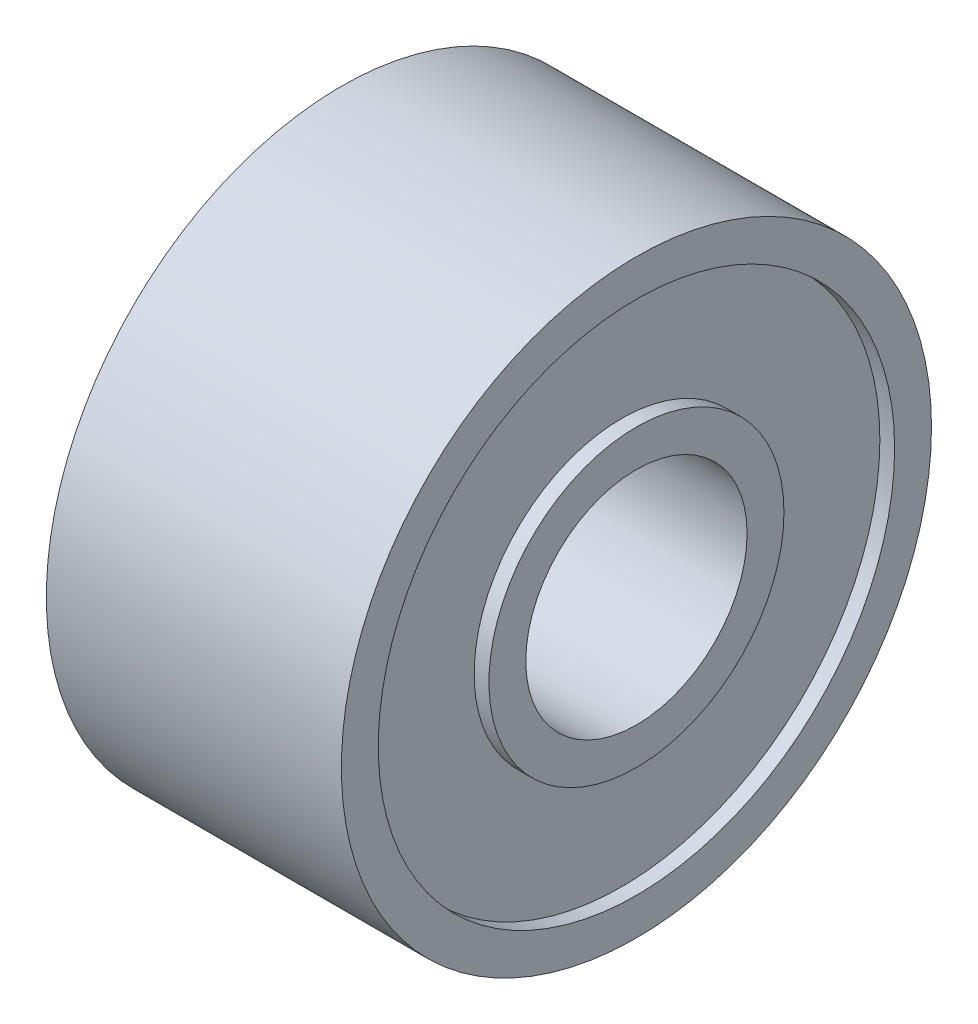
from build123d import *

# Parameters (mm, degrees)
SKETCH1_R           = 4
SKETCH1_R_2         = 1.5
BOSS_EXTRUDE1_DEPTH = 4
SKETCH2_R           = 3.5
SKETCH2_R_2         = 2
CUT_EXTRUDE1_DEPTH  = 0.2
CUT_EXTRUDE2_START  = -0.2
SKETCH3_R           = 3.5
SKETCH3_R_2         = 2
CUT_EXTRUDE2_DEPTH  = 0.2


with BuildPart() as part:
    # Sketch1 → Boss-Extrude1 (new body)
    with BuildSketch(Plane(origin=(0, 0, 0), x_dir=(0, 0, -1), z_dir=(1, 0, 0))):
        Circle(SKETCH1_R)
        Circle(SKETCH1_R_2, mode=Mode.SUBTRACT)
    extrude(amount=BOSS_EXTRUDE1_DEPTH)

    # Sketch2 → Cut-Extrude1 (cut)
    with BuildSketch(Plane(origin=(4, 0, 0), x_dir=(0, 0, -1), z_dir=(1, 0, 0))):
        Circle(SKETCH2_R)
        Circle(SKETCH2_R_2, mode=Mode.SUBTRACT)
    extrude(amount=-CUT_EXTRUDE1_DEPTH, mode=Mode.SUBTRACT)

    # Sketch3 → Cut-Extrude2 (cut)
    with BuildSketch(Plane.ZY.offset(CUT_EXTRUDE2_START)):
        Circle(SKETCH3_R)
        Circle(SKETCH3_R_2, mode=Mode.SUBTRACT)
    extrude(amount=CUT_EXTRUDE2_DEPTH, mode=Mode.SUBTRACT)


solid = part.part
